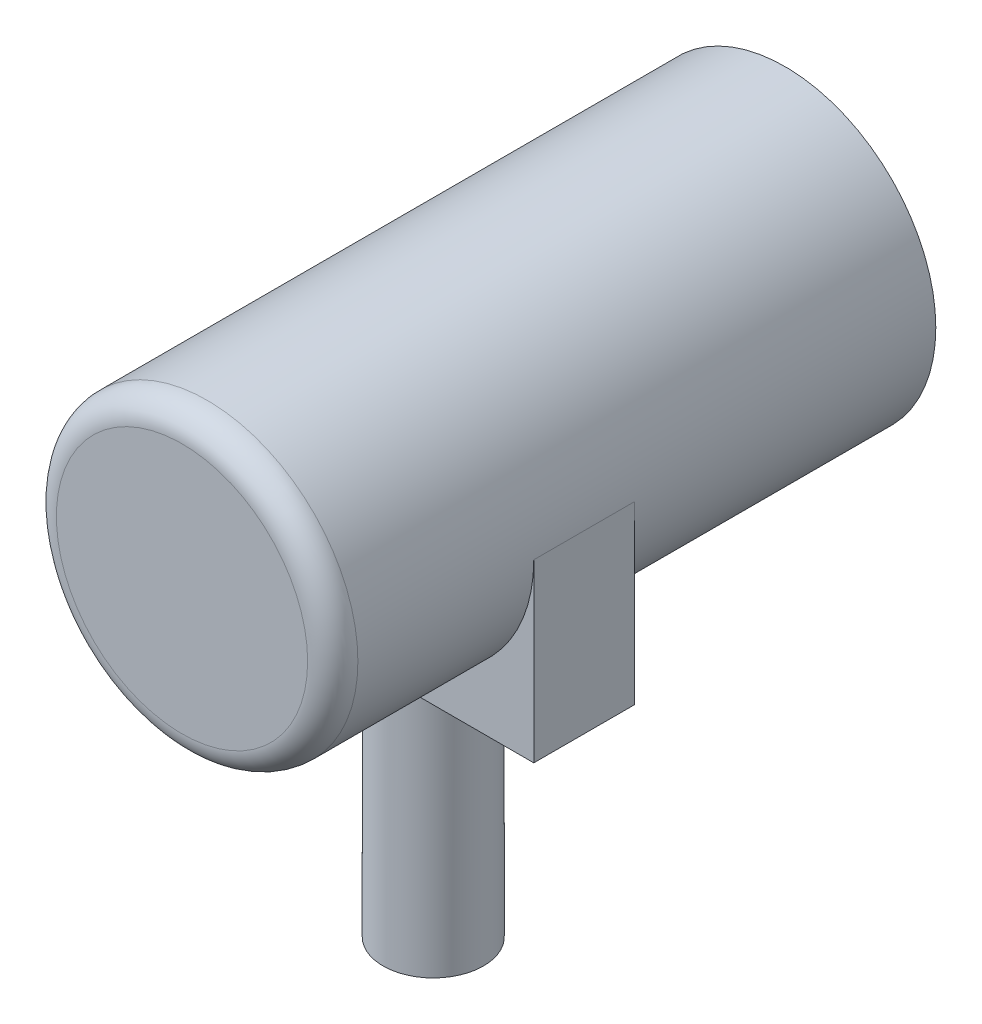
from build123d import *

# Parameters (mm, degrees)
TUBE_SKETCH_R             = 30
TUBE_EXTRUDE_DEPTH        = 120
TUBE_SHELL_T              = -5
SUPPRT_START              = 20
SUPPRT_BAND_EXTRUDE_DEPTH = 20
PIN_SKETCH_R              = 10
PIN_EXTRUDE_DEPTH         = 50
APERTURE_START            = -4
APERTURE_SKETCH_R         = 25
APERTURE_EXTRUDE_DEPTH    = 2
REAR_FILLET_R             = 5


with BuildPart() as part:
    # Tube Sketch → Tube Extrude (new body)
    with BuildSketch(Plane.XY):
        Circle(TUBE_SKETCH_R)
    extrude(amount=-TUBE_EXTRUDE_DEPTH)

    # Tube Shell
    tube_shell_openings = [part.faces().sort_by_distance(p)[0] for p in [
        (0, 0, -120),
    ]]
    offset(amount=TUBE_SHELL_T, openings=tube_shell_openings, kind=Kind.INTERSECTION)

    # Support Band Sketch → Supprt Band Extrude (add)
    with BuildSketch(Plane.XY.offset(-60).offset(SUPPRT_START)):
        with BuildLine():
            Line((-30, 0), (-30, -35))
            Line((-30, -35), (30, -35))
            Line((30, -35), (30, 0))
            ThreePointArc((30, 0), (0, -30), (-30, 0))
        make_face()
    extrude(amount=-SUPPRT_BAND_EXTRUDE_DEPTH)

    # Pin Sketch → Pin Extrude (add)
    with BuildSketch(Plane.XZ.offset(35)):
        with Locations((0, -50)):
            Circle(PIN_SKETCH_R)
    extrude(amount=PIN_EXTRUDE_DEPTH)

    # Aperture Sketch → Aperture Extrude (add)
    with BuildSketch(Plane(origin=(0, 0, -120), x_dir=(-1, 0, 0), z_dir=(0, 0, -1)).offset(APERTURE_START)):
        Circle(APERTURE_SKETCH_R)
    extrude(amount=APERTURE_EXTRUDE_DEPTH)

    # Rear Fillet
    rear_fillet_edges = [part.edges().sort_by_distance(p)[0] for p in [
        (-30, 0, 0),
    ]]
    fillet(rear_fillet_edges, radius=REAR_FILLET_R)


solid = part.part
